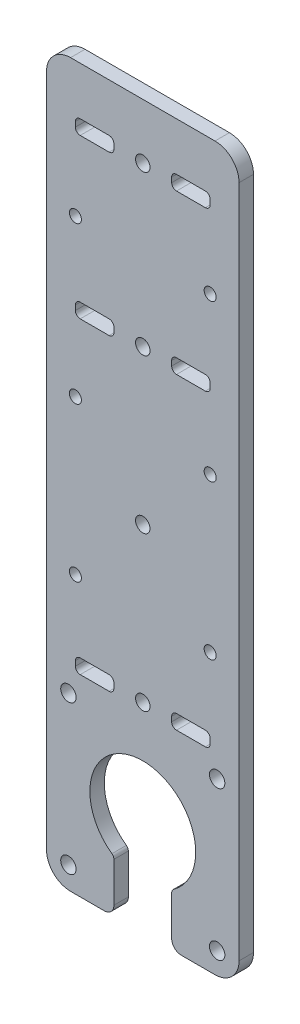
from build123d import *

# Parameters (mm, degrees)
SKETCH1_R                      = 1.6
BOSS_EXTRUDE1_DEPTH            = 3
FILLET1_R                      = 5
FILLET2_R                      = 2
FILLET3_R                      = 1
SKETCH2_W                      = 8
SKETCH2_H                      = 3
SKETCH2_R                      = 1.5
CUT_EXTRUDE1_DEPTH             = 3
FILLET4_R                      = 1
F_2_5_2_5_DIAMETER_HOLE1_D     = 2.5
F_2_5_2_5_DIAMETER_HOLE1_DEPTH = 6
F_2_5_2_5_DIAMETER_HOLE1_TIP   = 0.751075774


with BuildPart() as part:
    # Sketch1 → Boss-Extrude1 (new body)
    with BuildSketch(Plane.XY):
        with BuildLine():
            Line((20, 75), (-20, 75))
            Line((-20, 75), (-20, -75))
            Line((-20, -75), (-6, -75))
            Line((-6, -75), (-6, -64.219544457))
            ThreePointArc((-6, -64.219544457), (-5.244044241, -45.330460197), (11, -55))
            ThreePointArc((11, -55), (9.669539803, -60.244044241), (6, -64.219544457))
            Line((6, -64.219544457), (6, -75))
            Line((6, -75), (20, -75))
            Line((20, -75), (20, 75))
        make_face()
        with Locations((-15.450283169, -70.450283169)):
            Circle(SKETCH1_R, mode=Mode.SUBTRACT)
        with Locations((-15.450283169, -39.549716831)):
            Circle(SKETCH1_R, mode=Mode.SUBTRACT)
        with Locations((15.450283169, -70.450283169)):
            Circle(SKETCH1_R, mode=Mode.SUBTRACT)
        with Locations((15.450283169, -39.549716831)):
            Circle(SKETCH1_R, mode=Mode.SUBTRACT)
    extrude(amount=BOSS_EXTRUDE1_DEPTH)

    # Fillet1
    fillet1_edges = [part.edges().sort_by_distance(p)[0] for p in [
        (-20, -75, 1.5),
        (20, -75, 1.5),
        (-20, 75, 1.5),
        (20, 75, 1.5),
    ]]
    fillet(fillet1_edges, radius=FILLET1_R)

    # Fillet2
    fillet2_edges = [part.edges().sort_by_distance(p)[0] for p in [
        (6, -75, 1.5),
        (-6, -75, 1.5),
    ]]
    fillet(fillet2_edges, radius=FILLET2_R)

    # Fillet3
    fillet3_edges = [part.edges().sort_by_distance(p)[0] for p in [
        (6, -64.219544457, 1.5),
        (-6, -64.219544457, 1.5),
    ]]
    fillet(fillet3_edges, radius=FILLET3_R)

    # Sketch2 → Cut-Extrude1 (cut)
    with BuildSketch(Plane.XY.offset(3)):
        with Locations((-10, 63.5)):
            Rectangle(SKETCH2_W, SKETCH2_H)
        with Locations((10, 63.5)):
            Rectangle(SKETCH2_W, SKETCH2_H)
        with Locations((-10, 30.5)):
            Rectangle(SKETCH2_W, SKETCH2_H)
        with Locations((10, 30.5)):
            Rectangle(SKETCH2_W, SKETCH2_H)
        with Locations((-10, -33.5)):
            Rectangle(SKETCH2_W, SKETCH2_H)
        with Locations((10, -33.5)):
            Rectangle(SKETCH2_W, SKETCH2_H)
        with Locations((0, -33.5)):
            Circle(SKETCH2_R)
        with Locations((0, 30.5)):
            Circle(SKETCH2_R)
        with Locations((0, 63.5)):
            Circle(SKETCH2_R)
        with Locations((0, -1.5)):
            Circle(SKETCH2_R)
    extrude(amount=-CUT_EXTRUDE1_DEPTH, mode=Mode.SUBTRACT)

    # Fillet4
    fillet4_edges = [part.edges().sort_by_distance(p)[0] for p in [
        (-6, 29, 1.5),
        (-14, 29, 1.5),
        (-6, 32, 1.5),
        (14, -35, 1.5),
        (6, -35, 1.5),
        (6, -32, 1.5),
        (14, -32, 1.5),
        (-6, -35, 1.5),
        (-14, -35, 1.5),
        (-14, -32, 1.5),
        (-6, -32, 1.5),
        (14, 29, 1.5),
        (6, 29, 1.5),
        (6, 32, 1.5),
        (14, 32, 1.5),
        (-14, 32, 1.5),
        (14, 65, 1.5),
        (14, 62, 1.5),
        (6, 65, 1.5),
        (6, 62, 1.5),
        (-14, 62, 1.5),
        (-6, 62, 1.5),
        (-6, 65, 1.5),
        (-14, 65, 1.5),
    ]]
    fillet(fillet4_edges, radius=FILLET4_R)

    # Ø2.5 (2.5) Diameter Hole1
    with Locations(Plane.XY.offset(3)):
        with Locations((14, -17.5), (-14, -17.5), (-14, 14.5), (14, 14.5), (14, 47), (-14, 47)):
            Hole(F_2_5_2_5_DIAMETER_HOLE1_D / 2, depth=F_2_5_2_5_DIAMETER_HOLE1_DEPTH)
            with Locations((0, 0, -(F_2_5_2_5_DIAMETER_HOLE1_DEPTH + F_2_5_2_5_DIAMETER_HOLE1_TIP / 2))):  # 118° drill point
                Cone(0, F_2_5_2_5_DIAMETER_HOLE1_D / 2, F_2_5_2_5_DIAMETER_HOLE1_TIP, mode=Mode.SUBTRACT)


solid = part.part
